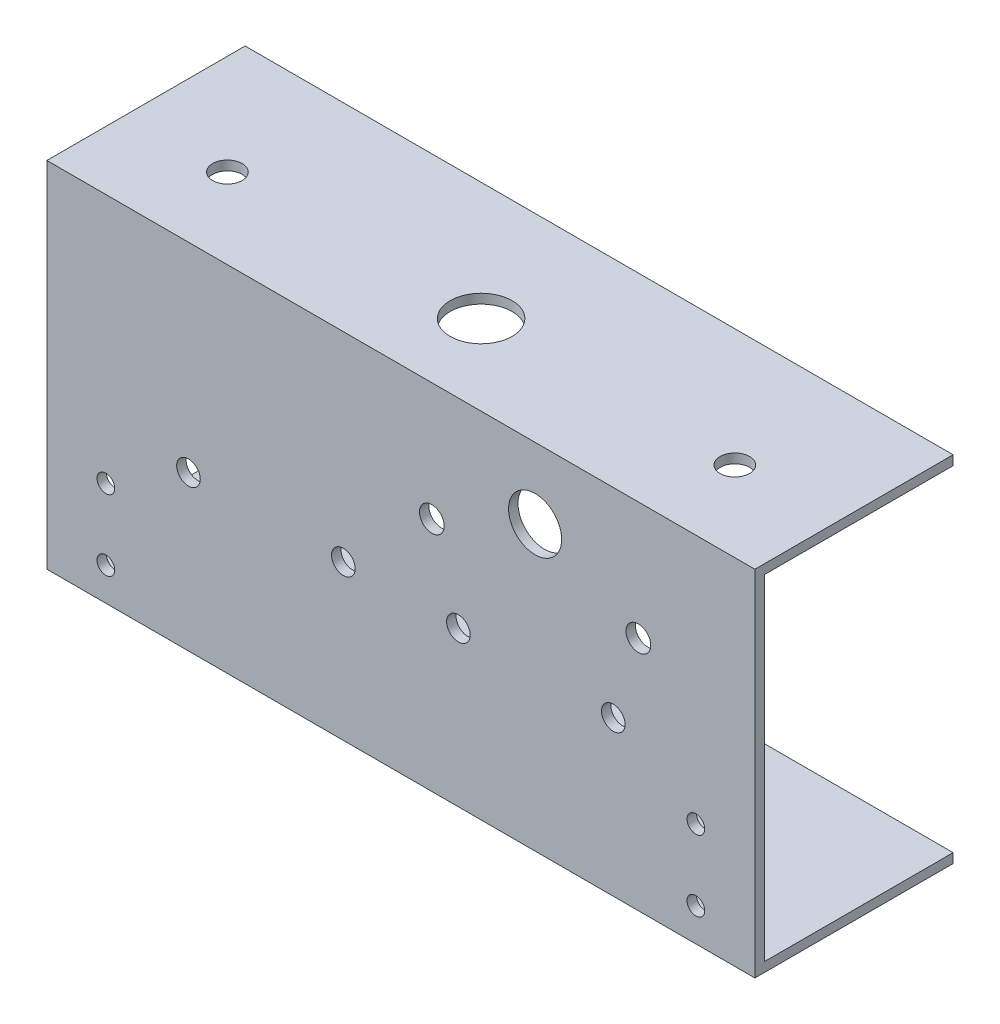
from build123d import *

# Parameters (mm, degrees)
SKETCH1_W           = 120
SKETCH1_H           = 32
SKETCH1_R           = 5.25
SKETCH1_R_2         = 2.5
BOSS_EXTRUDE1_DEPTH = 1.6
SKETCH3_W           = 120
SKETCH3_H           = 1.6
BOSS_EXTRUDE3_DEPTH = 60
SKETCH4_R           = 2.1
SKETCH4_R_2         = 4.5
CUT_EXTRUDE1_DEPTH  = 2
SKETCH6_R           = 2
CUT_EXTRUDE2_DEPTH  = 25
SKETCH7_R           = 1.5
CUT_EXTRUDE4_DEPTH  = 3


with BuildPart() as part:
    # Sketch1 → Boss-Extrude1 (new body)
    with BuildSketch(Plane(origin=(0, 0, 0), x_dir=(1, 0, 0), z_dir=(0, 1, 0))):
        with Locations((0, 4)):
            Rectangle(SKETCH1_W, SKETCH1_H)
        Circle(SKETCH1_R, mode=Mode.SUBTRACT)
        with Locations((-43, 0)):
            Circle(SKETCH1_R_2, mode=Mode.SUBTRACT)
        with Locations((43, 0)):
            Circle(SKETCH1_R_2, mode=Mode.SUBTRACT)
    boss_extrude1 = extrude(amount=BOSS_EXTRUDE1_DEPTH)

    # Sketch3 → Boss-Extrude3 (add)
    with BuildSketch(Plane.XZ):
        with Locations((0, 12.8)):
            Rectangle(SKETCH3_W, SKETCH3_H)
    extrude(amount=-BOSS_EXTRUDE3_DEPTH)

    # Mirror1: Boss-Extrude1 across plane
    add(boss_extrude1.mirror(Plane.ZX.offset(30)))

    # Sketch4 → Cut-Extrude1 (cut)
    with BuildSketch(Plane.XY.offset(13.6)):
        with Locations((5.25, 40)):
            Circle(SKETCH4_R)
        with Locations((22.75, 48)):
            Circle(SKETCH4_R_2)
        with Locations((40.25, 40)):
            Circle(SKETCH4_R)
    extrude(amount=-CUT_EXTRUDE1_DEPTH, mode=Mode.SUBTRACT)

    # Sketch6 → Cut-Extrude2 (cut)
    with BuildSketch(Plane(origin=(124.244525073, 40.7, 12), x_dir=(1, 0, 0), z_dir=(0, 0, 1))):
        with Locations((-160.244525073, -14.5)):
            Circle(SKETCH6_R)
        with Locations((-133.994525073, -14.5)):
            Circle(SKETCH6_R)
        with Locations((-114.494525073, -14.5)):
            Circle(SKETCH6_R)
        with Locations((-88.244525073, -14.5)):
            Circle(SKETCH6_R)
    extrude(amount=CUT_EXTRUDE2_DEPTH, mode=Mode.SUBTRACT)

    # Sketch7 → Cut-Extrude4 (cut)
    with BuildSketch(Plane(origin=(0, 0, 12), x_dir=(-1, 0, 0), z_dir=(0, 0, -1))):
        with Locations((-50, 17.6)):
            Circle(SKETCH7_R)
        with Locations((-50, 5.6)):
            Circle(SKETCH7_R)
        with Locations((50, 5.6)):
            Circle(SKETCH7_R)
        with Locations((50, 17.6)):
            Circle(SKETCH7_R)
    extrude(amount=-CUT_EXTRUDE4_DEPTH, mode=Mode.SUBTRACT)


solid = part.part
